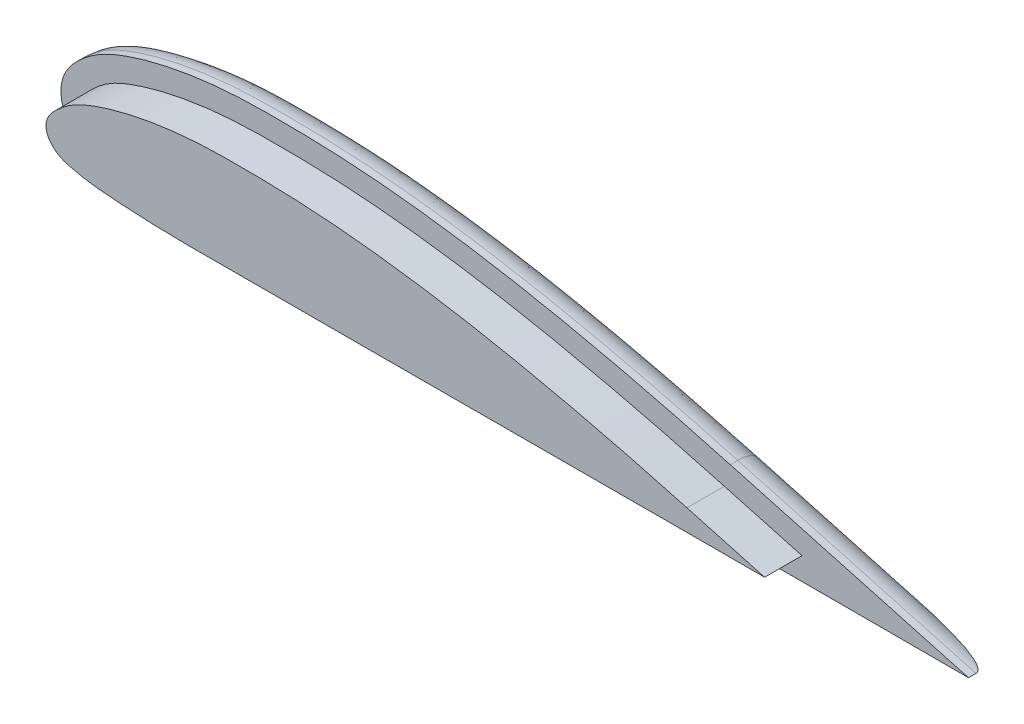
from build123d import *

# Parameters (mm, degrees)
BOSS_EXTRUDE1_DEPTH = 10
FILLET1_R           = 4
CUT_EXTRUDE1_DEPTH  = 5


with BuildPart() as part:
    # Sketch1 → Boss-Extrude1 (new body)
    with BuildSketch(Plane.XY):
        with BuildLine():
            Line((441.393772372, 20.11245238), (474.43313548, 20.11245238))
            Line((474.43313548, 20.11245238), (442.557049848, 28.856277993))
            add(Edge.make_bspline(
                [(442.557049848, 28.856277993), (439.072672673, 29.812066189), (432.09991262, 31.671596216), (421.486806006, 34.110578028), (410.779849111, 36.19753981), (401.720197274, 37.488657384), (394.412818539, 38.20453267), (388.865337546, 38.535909849), (383.377043684, 38.645396216), (378.7767391, 38.631004567), (374.963490259, 38.431919098), (372.066182641, 38.140016342), (369.210683302, 37.706967221), (366.827818433, 37.231436262), (364.908429326, 36.753895892), (363.479940401, 36.349485655), (362.056434922, 35.895767331), (360.572839349, 35.352857227), (359.287698264, 34.784145271), (358.216447641, 34.21460014), (357.389050585, 33.706898074), (356.552615658, 33.103064875), (355.820762746, 32.475335753), (355.354503463, 32.044209503), (354.855699671, 31.552849553), (354.389957132, 31.025585157), (353.964999314, 30.449203447), (353.586282933, 29.767186255), (353.227738955, 28.932944297), (352.961298812, 27.649941627), (353.111643283, 26.298326889), (353.365330175, 25.450623284), (353.695602528, 24.752886461), (353.998210399, 24.262418144), (354.347839516, 23.793022868), (354.788881726, 23.301715107), (355.325142217, 22.811112843), (356.055967315, 22.286834279), (356.839748986, 21.871835881), (357.765467063, 21.506816056), (358.640116289, 21.281010932), (359.288045988, 21.130261844), (360.069783324, 20.956248021), (360.904853145, 20.805577699), (361.971898146, 20.65201194), (363.214024728, 20.526416591), (364.578709921, 20.410081097), (365.978183778, 20.304620288), (367.378711377, 20.219984968), (369.228950932, 20.131407076), (371.530679735, 20.056360098), (374.271249485, 20.010918971), (376.991001378, 19.994447782), (379.696108674, 19.996368347), (383.274859524, 20.009444007), (387.735021397, 20.017659911), (393.10446141, 20.024425958), (398.470497743, 20.035035638), (403.835453794, 20.044763259), (410.989397892, 20.05802128), (419.931476298, 20.073638873), (430.662185952, 20.093254902), (437.816630749, 20.105643074), (441.393772372, 20.11245238)],
                knots=[0, 0, 0, 0, 0.062498476, 0.124996951, 0.187495427, 0.249993902, 0.28124314, 0.312492378, 0.343741616, 0.374990854, 0.390615473, 0.406240092, 0.42186471, 0.437489329, 0.445301639, 0.453113948, 0.460926258, 0.468738567, 0.476550877, 0.480457031, 0.484363186, 0.488269341, 0.492175496, 0.49608165, 0.498034728, 0.499987805, 0.501940882, 0.502917421, 0.50389396, 0.505847037, 0.506823576, 0.507800114, 0.508776653, 0.509753192, 0.51072973, 0.511706269, 0.513659347, 0.515612424, 0.517565501, 0.519518579, 0.523424733, 0.527330888, 0.531237043, 0.535143198, 0.539049352, 0.546861662, 0.554673971, 0.562486281, 0.57029859, 0.5781109, 0.593735518, 0.609360137, 0.624984756, 0.640609375, 0.656233994, 0.687483232, 0.71873247, 0.749981707, 0.781230945, 0.812480183, 0.874978659, 0.937477134, 0.99997561, 0.99997561, 0.99997561, 0.99997561], degree=3))
        make_face()
    extrude(amount=BOSS_EXTRUDE1_DEPTH)

    # Fillet1
    fillet1_edges = [part.edges().sort_by_distance(p)[0] for p in [
        (458.495092664, 24.484365186, 10),
        (457.913453926, 20.11245238, 10),
        (458.495092664, 24.484365186, 10),
    ]]
    fillet(fillet1_edges, radius=FILLET1_R)

    # Sketch2 → Cut-Extrude1 (cut)
    with BuildSketch(Plane(origin=(0, 0, 0), x_dir=(-1, 0, 0), z_dir=(0, 0, -1))):
        with BuildLine():
            Line((-442.557049848, 28.856277993), (-474.43313548, 20.11245238))
            Line((-474.43313548, 20.11245238), (-441.393772372, 20.11245238))
            add(Edge.make_bspline(
                [(-441.393772372, 20.11245238), (-437.816630749, 20.105643074), (-430.662185952, 20.093254902), (-419.931476298, 20.073638873), (-410.989397892, 20.05802128), (-403.835453794, 20.044763259), (-398.470497743, 20.035035638), (-393.10446141, 20.024425958), (-387.735021397, 20.017659911), (-383.274859524, 20.009444007), (-379.696108674, 19.996368347), (-376.991001378, 19.994447782), (-374.271249485, 20.010918971), (-371.530679735, 20.056360098), (-369.228950932, 20.131407076), (-367.378711377, 20.219984968), (-365.978183778, 20.304620288), (-364.578709921, 20.410081097), (-363.214024728, 20.526416591), (-361.971898146, 20.65201194), (-360.904853145, 20.805577699), (-360.069783324, 20.956248021), (-359.288045988, 21.130261844), (-358.640116289, 21.281010932), (-357.765467063, 21.506816056), (-356.839748986, 21.871835881), (-356.055967315, 22.286834279), (-355.325142217, 22.811112843), (-354.788881726, 23.301715107), (-354.347839516, 23.793022868), (-353.998210399, 24.262418144), (-353.695602528, 24.752886461), (-353.365330175, 25.450623284), (-353.111643283, 26.298326889), (-352.961298812, 27.649941627), (-353.227738955, 28.932944297), (-353.586282933, 29.767186255), (-353.964999314, 30.449203447), (-354.389957132, 31.025585157), (-354.855699671, 31.552849553), (-355.354503463, 32.044209503), (-355.820762746, 32.475335753), (-356.552615658, 33.103064875), (-357.389050585, 33.706898074), (-358.216447641, 34.21460014), (-359.287698264, 34.784145271), (-360.572839349, 35.352857227), (-362.056434922, 35.895767331), (-363.479940401, 36.349485655), (-364.908429326, 36.753895892), (-366.827818433, 37.231436262), (-369.210683302, 37.706967221), (-372.066182641, 38.140016342), (-374.963490259, 38.431919098), (-378.7767391, 38.631004567), (-383.377043684, 38.645396216), (-388.865337546, 38.535909849), (-394.412818539, 38.20453267), (-401.720197274, 37.488657384), (-410.779849111, 36.19753981), (-421.486806006, 34.110578028), (-432.09991262, 31.671596216), (-439.072672673, 29.812066189), (-442.557049848, 28.856277993)],
                knots=[0, 0, 0, 0, 0.062498476, 0.124996951, 0.187495427, 0.218744665, 0.249993902, 0.28124314, 0.312492378, 0.343741616, 0.359366235, 0.374990854, 0.390615473, 0.406240092, 0.42186471, 0.42967702, 0.437489329, 0.445301639, 0.453113948, 0.460926258, 0.464832412, 0.468738567, 0.472644722, 0.476550877, 0.480457031, 0.482410109, 0.484363186, 0.486316263, 0.488269341, 0.48924588, 0.490222418, 0.491198957, 0.492175496, 0.493152034, 0.494128573, 0.49608165, 0.497058189, 0.498034728, 0.499987805, 0.501940882, 0.50389396, 0.507800114, 0.511706269, 0.515612424, 0.519518579, 0.523424733, 0.531237043, 0.539049352, 0.546861662, 0.554673971, 0.562486281, 0.5781109, 0.593735518, 0.609360137, 0.624984756, 0.656233994, 0.687483232, 0.71873247, 0.749981707, 0.812480183, 0.874978659, 0.937477134, 0.99997561, 0.99997561, 0.99997561, 0.99997561], degree=3))
        make_face()
        with BuildLine():
            Line((-441.763445198, 25.963149641), (-452.155815088, 23.11245238))
            Line((-452.155815088, 23.11245238), (-441.390917034, 23.11245238))
            add(Edge.make_bspline(
                [(-441.390917034, 23.11245238), (-426.562730802, 23.084226032), (-411.734546724, 23.060169519), (-393.199313915, 23.024847888), (-389.49226892, 23.020817988), (-383.931699141, 23.010343927), (-382.07817439, 23.003966397), (-378.371126338, 22.994017121), (-376.51760448, 22.993240124), (-372.810580636, 23.030156852), (-370.957078695, 23.067937652), (-368.176855736, 23.182595637), (-367.25088238, 23.230178674), (-365.401864691, 23.352790661), (-364.478546565, 23.425932746), (-363.095412698, 23.553969032), (-362.634705221, 23.599999118), (-361.715757156, 23.716580881), (-361.257538937, 23.787354917), (-360.572829895, 23.919542503), (-360.345094214, 23.968581804), (-359.890026999, 24.070677749), (-359.662628008, 24.12295548), (-359.209955736, 24.233305516), (-358.983981836, 24.289579828), (-358.540666889, 24.428326938), (-358.322542976, 24.508423941), (-357.89792812, 24.703921021), (-357.689527657, 24.819590385), (-357.303069694, 25.085193892), (-357.121331177, 25.232792993), (-356.868675168, 25.479885405), (-356.786958595, 25.566020566), (-356.635588018, 25.744945077), (-356.565652141, 25.838195245), (-356.367740362, 26.125783149), (-356.258267453, 26.334880197), (-356.095150297, 26.778615981), (-356.048624023, 27.008805919), (-356.023786729, 27.482492483), (-356.054775166, 27.714425026), (-356.138393176, 28.058122636), (-356.172931656, 28.170976491), (-356.260209371, 28.387541527), (-356.312340547, 28.492065444), (-356.425630778, 28.697117642), (-356.487376582, 28.797889266), (-356.619395581, 28.990353549), (-356.690396393, 29.082044457), (-356.910244682, 29.350888634), (-357.06770137, 29.520209006), (-357.398075052, 29.844783537), (-357.566718042, 30.003926303), (-357.912114606, 30.314832602), (-358.087112093, 30.467234138), (-358.444532187, 30.759941674), (-358.627803413, 30.899179001), (-359.190022076, 31.297536488), (-359.581707813, 31.536782104), (-360.391462879, 31.974109144), (-360.810042864, 32.174306571), (-362.083141076, 32.726680794), (-362.947997818, 33.030969573), (-364.692154838, 33.582254636), (-365.571886611, 33.827539324), (-367.344899893, 34.264361595), (-368.238517575, 34.454565696), (-370.037096793, 34.78997676), (-370.941660233, 34.936762832), (-372.761877211, 35.186344401), (-373.675856353, 35.288259974), (-375.497367298, 35.447255891), (-376.40689062, 35.503590105), (-379.132820961, 35.622969191), (-380.946710752, 35.638691575), (-384.571734615, 35.618330329), (-386.383152885, 35.587589458), (-390.0023509, 35.457705446), (-391.810044208, 35.356937329), (-395.421773091, 35.086637703), (-397.225767387, 34.916330155), (-402.633342676, 34.32254711), (-406.232678018, 33.819255658), (-413.421260709, 32.623023997), (-416.997592544, 31.931158193), (-424.119266066, 30.426194438), (-427.666451448, 29.61393531), (-434.732320493, 27.864612486), (-438.250807977, 26.926689759), (-441.763445198, 25.963149641)],
                knots=[0, 0, 0, 0, 0.25, 0.25, 0.3125, 0.3125, 0.34375, 0.34375, 0.375, 0.375, 0.40625, 0.40625, 0.421875, 0.421875, 0.4375, 0.4375, 0.4453125, 0.4453125, 0.453125, 0.453125, 0.45703125, 0.45703125, 0.4609375, 0.4609375, 0.46484375, 0.46484375, 0.46875, 0.46875, 0.47265625, 0.47265625, 0.4765625, 0.4765625, 0.478515625, 0.478515625, 0.48046875, 0.48046875, 0.484375, 0.484375, 0.48828125, 0.48828125, 0.4921875, 0.4921875, 0.494140625, 0.494140625, 0.49609375, 0.49609375, 0.498046875, 0.498046875, 0.5, 0.5, 0.50390625, 0.50390625, 0.5078125, 0.5078125, 0.51171875, 0.51171875, 0.515625, 0.515625, 0.5234375, 0.5234375, 0.53125, 0.53125, 0.546875, 0.546875, 0.5625, 0.5625, 0.578125, 0.578125, 0.59375, 0.59375, 0.609375, 0.609375, 0.625, 0.625, 0.65625, 0.65625, 0.6875, 0.6875, 0.71875, 0.71875, 0.75, 0.75, 0.8125, 0.8125, 0.875, 0.875, 0.9375, 0.9375, 1, 1, 1, 1], degree=3))
        make_face(mode=Mode.SUBTRACT)
    extrude(amount=-CUT_EXTRUDE1_DEPTH, mode=Mode.SUBTRACT)


with BuildPart() as body_2:
    # Mirror1: mirrored copy
    add(part.part.mirror(Plane(origin=(354.382589325, 30.998186214, 0), x_dir=(1, 0, 0), z_dir=(0, 0, -1))))


solid = body_2.part
